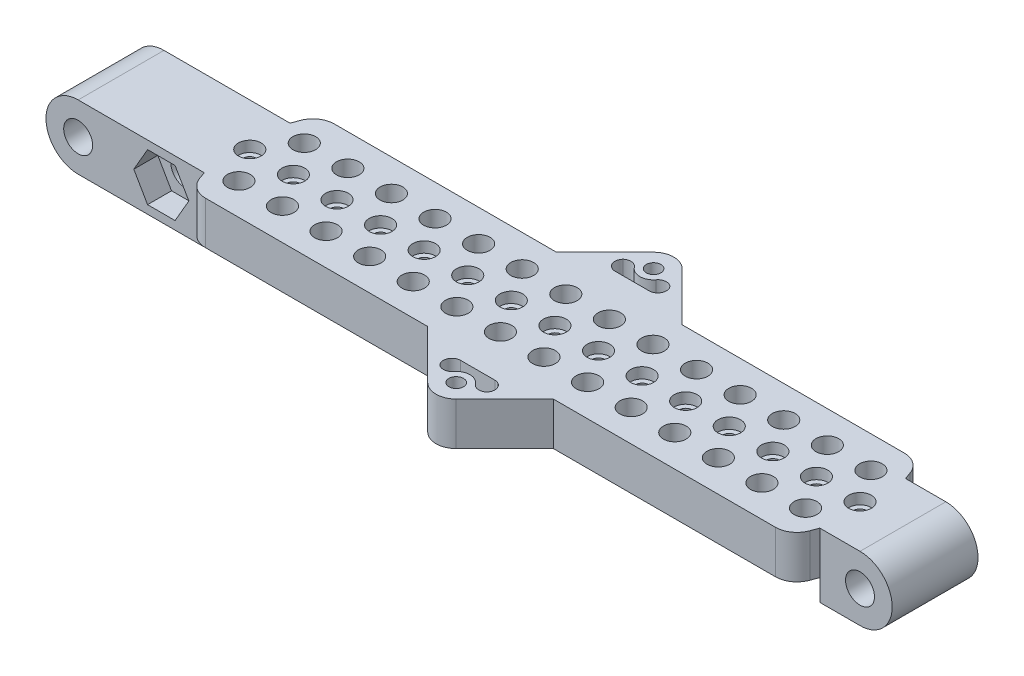
from build123d import *

# Parameters (mm, degrees)
SKETCH1_R           = 4
SKETCH1_R_2         = 1.5
BOSS_EXTRUDE1_DEPTH = 15
SKETCH3_R           = 2.65
CUT_EXTRUDE1_DEPTH  = 2.5
BOSS_EXTRUDE2_START = -15
BOSS_EXTRUDE2_DEPTH = 15
LPATTERN2_COUNT     = 14
LPATTERN2_PITCH     = 10.16
LPATTERN3_COUNT     = 2
LPATTERN3_PITCH     = 142.24
SKETCH4_R           = 2.65
BOSS_EXTRUDE4_DEPTH = 10
FILLET1_R           = 5
SKETCH5_R           = 1.7
BOSS_EXTRUDE5_DEPTH = 10
FILLET2_R           = 2
BOSS_EXTRUDE6_DEPTH = 15
BOSS_EXTRUDE7_DEPTH = 20
CUT_EXTRUDE2_DEPTH  = 5.588
SKETCH8_R           = 3.3734375
CUT_EXTRUDE3_DEPTH  = 152.764381856
BOSS_EXTRUDE8_DEPTH = 15
BOSS_EXTRUDE9_DEPTH = 20
SKETCH13_R          = 3.3734375
CUT_EXTRUDE4_DEPTH  = 165.812492245


with BuildPart() as part:
    # Sketch1 → Boss-Extrude1 (new body)
    with BuildSketch(Plane(origin=(0, 0, 0), x_dir=(1, 0, 0), z_dir=(0, 1, 0))):
        with Locations(Location((0, 0, 0), (0, 0, 270))):
            Circle(SKETCH1_R)
        with Locations(Location((0, 0, 0), (0, 0, 270))):
            Circle(SKETCH1_R_2, mode=Mode.SUBTRACT)
    boss_extrude1 = extrude(amount=BOSS_EXTRUDE1_DEPTH)

    # Sketch3 → Cut-Extrude1 (cut)
    with BuildSketch(Plane(origin=(0, 15, 0), x_dir=(1, 0, 0), z_dir=(0, 1, 0))):
        with Locations(Location((0, 0, 0), (0, 0, 270))):
            Circle(SKETCH3_R)
    cut_extrude1 = extrude(amount=-CUT_EXTRUDE1_DEPTH, mode=Mode.SUBTRACT)

    # Sketch2 → Boss-Extrude2 (add)
    with BuildSketch(Plane(origin=(0, 15, 0), x_dir=(1, 0, 0), z_dir=(0, 1, 0)).offset(BOSS_EXTRUDE2_START)):
        with BuildLine():
            Line((0, 4), (10.16, 4))
            ThreePointArc((10.16, 4), (6.16, 0), (10.16, -4))
            Line((10.16, -4), (0, -4))
            ThreePointArc((0, -4), (4, 0), (0, 4))
        make_face()
    extrude(amount=BOSS_EXTRUDE2_DEPTH)


with BuildPart() as lpattern2_1:
    # LPattern2: pattern copy
    add(part.part.moved(Location(Vector(1, 0, 0) * (1 * LPATTERN2_PITCH))))


with BuildPart() as lpattern2_2:
    # LPattern2: pattern copy
    add(part.part.moved(Location(Vector(1, 0, 0) * (2 * LPATTERN2_PITCH))))


with BuildPart() as lpattern2_3:
    # LPattern2: pattern copy
    add(part.part.moved(Location(Vector(1, 0, 0) * (3 * LPATTERN2_PITCH))))


with BuildPart() as lpattern2_4:
    # LPattern2: pattern copy
    add(part.part.moved(Location(Vector(1, 0, 0) * (4 * LPATTERN2_PITCH))))


with BuildPart() as lpattern2_5:
    # LPattern2: pattern copy
    add(part.part.moved(Location(Vector(1, 0, 0) * (5 * LPATTERN2_PITCH))))


with BuildPart() as lpattern2_6:
    # LPattern2: pattern copy
    add(part.part.moved(Location(Vector(1, 0, 0) * (6 * LPATTERN2_PITCH))))


with BuildPart() as lpattern2_7:
    # LPattern2: pattern copy
    add(part.part.moved(Location(Vector(1, 0, 0) * (7 * LPATTERN2_PITCH))))


with BuildPart() as lpattern2_8:
    # LPattern2: pattern copy
    add(part.part.moved(Location(Vector(1, 0, 0) * (8 * LPATTERN2_PITCH))))


with BuildPart() as lpattern2_9:
    # LPattern2: pattern copy
    add(part.part.moved(Location(Vector(1, 0, 0) * (9 * LPATTERN2_PITCH))))


with BuildPart() as lpattern2_10:
    # LPattern2: pattern copy
    add(part.part.moved(Location(Vector(1, 0, 0) * (10 * LPATTERN2_PITCH))))


with BuildPart() as lpattern2_11:
    # LPattern2: pattern copy
    add(part.part.moved(Location(Vector(1, 0, 0) * (11 * LPATTERN2_PITCH))))


with BuildPart() as lpattern2_12:
    # LPattern2: pattern copy
    add(part.part.moved(Location(Vector(1, 0, 0) * (12 * LPATTERN2_PITCH))))


with BuildPart() as lpattern2_13:
    # LPattern2: pattern copy
    add(part.part.moved(Location(Vector(1, 0, 0) * (13 * LPATTERN2_PITCH))))

    # LPattern3: Boss-Extrude1, Cut-Extrude1 ×2
    with Locations(*[(i * LPATTERN3_PITCH, 0, 0) for i in range(1, LPATTERN3_COUNT)]):
        add(boss_extrude1)
        add(cut_extrude1, mode=Mode.SUBTRACT)


with BuildPart() as lpattern2_11_1:
    add(lpattern2_11.part)

    # Combine1: union LPattern2_6, LPattern2_1, LPattern2_13, LPattern2_8, LPattern2_3, LPattern2_10, LPattern2_5, LPattern2_12, LPattern2_7, LPattern2_2, LPattern2_4, LPattern2_9, part
    add(lpattern2_6.part)
    add(lpattern2_1.part)
    add(lpattern2_13.part)
    add(lpattern2_8.part)
    add(lpattern2_3.part)
    add(lpattern2_10.part)
    add(lpattern2_5.part)
    add(lpattern2_12.part)
    add(lpattern2_7.part)
    add(lpattern2_2.part)
    add(lpattern2_4.part)
    add(lpattern2_9.part)
    add(part.part)

    # Sketch4 → Boss-Extrude4 (add)
    with BuildSketch(Plane(origin=(0, 15, 0), x_dir=(1, 0, 0), z_dir=(0, 1, 0))):
        with BuildLine():
            Line((-3.758770483, 1.368080573), (1.202842424, 15))
            Line((1.202842424, 15), (141.037157576, 15))
            Line((141.037157576, 15), (145.998770483, 1.368080573))
            ThreePointArc((145.998770483, 1.368080573), (146.24, 0), (145.998770483, -1.368080573))
            Line((145.998770483, -1.368080573), (141.037157576, -15))
            Line((141.037157576, -15), (1.202842424, -15))
            Line((1.202842424, -15), (-3.758770483, -1.368080573))
            ThreePointArc((-3.758770483, -1.368080573), (-4, 0), (-3.758770483, 1.368080573))
        make_face()
        with Locations(Location((5.08, 7.62, 0), (0, 0, 270))):
            Circle(SKETCH4_R, mode=Mode.SUBTRACT)
        with Locations(Location((15.24, 7.62, 0), (0, 0, 270))):
            Circle(SKETCH4_R, mode=Mode.SUBTRACT)
        with Locations(Location((25.4, 7.62, 0), (0, 0, 270))):
            Circle(SKETCH4_R, mode=Mode.SUBTRACT)
        with Locations(Location((35.56, 7.62, 0), (0, 0, 270))):
            Circle(SKETCH4_R, mode=Mode.SUBTRACT)
        with Locations(Location((45.72, 7.62, 0), (0, 0, 270))):
            Circle(SKETCH4_R, mode=Mode.SUBTRACT)
        with Locations(Location((55.88, 7.62, 0), (0, 0, 270))):
            Circle(SKETCH4_R, mode=Mode.SUBTRACT)
        with Locations(Location((66.04, 7.62, 0), (0, 0, 270))):
            Circle(SKETCH4_R, mode=Mode.SUBTRACT)
        with Locations(Location((76.2, 7.62, 0), (0, 0, 270))):
            Circle(SKETCH4_R, mode=Mode.SUBTRACT)
        with Locations(Location((86.36, 7.62, 0), (0, 0, 270))):
            Circle(SKETCH4_R, mode=Mode.SUBTRACT)
        with Locations(Location((96.52, 7.62, 0), (0, 0, 270))):
            Circle(SKETCH4_R, mode=Mode.SUBTRACT)
        with Locations(Location((106.68, 7.62, 0), (0, 0, 270))):
            Circle(SKETCH4_R, mode=Mode.SUBTRACT)
        with Locations(Location((116.84, 7.62, 0), (0, 0, 270))):
            Circle(SKETCH4_R, mode=Mode.SUBTRACT)
        with Locations(Location((127, 7.62, 0), (0, 0, 270))):
            Circle(SKETCH4_R, mode=Mode.SUBTRACT)
        with Locations(Location((137.16, 7.62, 0), (0, 0, 270))):
            Circle(SKETCH4_R, mode=Mode.SUBTRACT)
        with Locations(Location((15.24, -7.62, 0), (0, 0, 270))):
            Circle(SKETCH4_R, mode=Mode.SUBTRACT)
        with Locations(Location((25.4, -7.62, 0), (0, 0, 270))):
            Circle(SKETCH4_R, mode=Mode.SUBTRACT)
        with Locations(Location((35.56, -7.62, 0), (0, 0, 270))):
            Circle(SKETCH4_R, mode=Mode.SUBTRACT)
        with Locations(Location((45.72, -7.62, 0), (0, 0, 270))):
            Circle(SKETCH4_R, mode=Mode.SUBTRACT)
        with Locations(Location((55.88, -7.62, 0), (0, 0, 270))):
            Circle(SKETCH4_R, mode=Mode.SUBTRACT)
        with Locations(Location((66.04, -7.62, 0), (0, 0, 270))):
            Circle(SKETCH4_R, mode=Mode.SUBTRACT)
        with Locations(Location((76.2, -7.62, 0), (0, 0, 270))):
            Circle(SKETCH4_R, mode=Mode.SUBTRACT)
        with Locations(Location((86.36, -7.62, 0), (0, 0, 270))):
            Circle(SKETCH4_R, mode=Mode.SUBTRACT)
        with Locations(Location((96.52, -7.62, 0), (0, 0, 270))):
            Circle(SKETCH4_R, mode=Mode.SUBTRACT)
        with Locations(Location((106.68, -7.62, 0), (0, 0, 270))):
            Circle(SKETCH4_R, mode=Mode.SUBTRACT)
        with Locations(Location((116.84, -7.62, 0), (0, 0, 270))):
            Circle(SKETCH4_R, mode=Mode.SUBTRACT)
        with Locations(Location((127, -7.62, 0), (0, 0, 270))):
            Circle(SKETCH4_R, mode=Mode.SUBTRACT)
        with Locations(Location((137.16, -7.62, 0), (0, 0, 270))):
            Circle(SKETCH4_R, mode=Mode.SUBTRACT)
        with Locations(Location((5.08, -7.62, 0), (0, 0, 270))):
            Circle(SKETCH4_R, mode=Mode.SUBTRACT)
        with Locations(Location((0, 0, 0), (0, 0, 270))):
            Circle(SKETCH4_R, mode=Mode.SUBTRACT)
        with Locations(Location((10.16, 0, 0), (0, 0, 270))):
            Circle(SKETCH4_R, mode=Mode.SUBTRACT)
        with Locations(Location((20.32, 0, 0), (0, 0, 270))):
            Circle(SKETCH4_R, mode=Mode.SUBTRACT)
        with Locations(Location((30.48, 0, 0), (0, 0, 270))):
            Circle(SKETCH4_R, mode=Mode.SUBTRACT)
        with Locations(Location((40.64, 0, 0), (0, 0, 270))):
            Circle(SKETCH4_R, mode=Mode.SUBTRACT)
        with Locations(Location((50.8, 0, 0), (0, 0, 270))):
            Circle(SKETCH4_R, mode=Mode.SUBTRACT)
        with Locations(Location((60.96, 0, 0), (0, 0, 270))):
            Circle(SKETCH4_R, mode=Mode.SUBTRACT)
        with Locations(Location((71.12, 0, 0), (0, 0, 270))):
            Circle(SKETCH4_R, mode=Mode.SUBTRACT)
        with Locations(Location((81.28, 0, 0), (0, 0, 270))):
            Circle(SKETCH4_R, mode=Mode.SUBTRACT)
        with Locations(Location((91.44, 0, 0), (0, 0, 270))):
            Circle(SKETCH4_R, mode=Mode.SUBTRACT)
        with Locations(Location((101.6, 0, 0), (0, 0, 270))):
            Circle(SKETCH4_R, mode=Mode.SUBTRACT)
        with Locations(Location((111.76, 0, 0), (0, 0, 270))):
            Circle(SKETCH4_R, mode=Mode.SUBTRACT)
        with Locations(Location((121.92, 0, 0), (0, 0, 270))):
            Circle(SKETCH4_R, mode=Mode.SUBTRACT)
        with Locations(Location((132.08, 0, 0), (0, 0, 270))):
            Circle(SKETCH4_R, mode=Mode.SUBTRACT)
        with Locations(Location((142.24, 0, 0), (0, 0, 270))):
            Circle(SKETCH4_R, mode=Mode.SUBTRACT)
    extrude(amount=-BOSS_EXTRUDE4_DEPTH)

    # Fillet1
    fillet1_edges = [lpattern2_11_1.edges().sort_by_distance(p)[0] for p in [
        (1.202842424, 10, -15),
        (141.037157576, 10, -15),
        (141.037157576, 10, 15),
        (1.202842424, 10, 15),
    ]]
    fillet(fillet1_edges, radius=FILLET1_R)

    # Sketch5 → Boss-Extrude5 (add)
    # profile 1 of 2: a face of its own
    with BuildSketch(Plane(origin=(0, 15, 0), x_dir=(1, 0, 0), z_dir=(0, 1, 0))):
        with BuildLine():
            Line((67.796598128, 26.323401872), (56.473196257, 15))
            Line((56.473196257, 15), (85.766803743, 15))
            Line((85.766803743, 15), (74.443401872, 26.323401872))
            ThreePointArc((74.443401872, 26.323401872), (71.12, 27.7), (67.796598128, 26.323401872))
        make_face()
        with Locations(Location((71.12, 23, 0), (0, 0, 270))):
            Circle(SKETCH5_R, mode=Mode.SUBTRACT)
        with BuildLine():
            Line((62.301623382, 18), (67.996315911, 23.694692529))
            ThreePointArc((67.996315911, 23.694692529), (71.12, 19.8), (74.243684089, 23.694692529))
            Line((74.243684089, 23.694692529), (79.938376618, 18))
            Line((79.938376618, 18), (62.301623382, 18))
        make_face(mode=Mode.SUBTRACT)
    # profile 2 of 2: a face of its own
    with BuildSketch(Plane(origin=(0, 15, 0), x_dir=(1, 0, 0), z_dir=(0, 1, 0))):
        with BuildLine():
            Line((74.443401872, -26.323401872), (85.766803743, -15))
            Line((85.766803743, -15), (56.473196257, -15))
            Line((56.473196257, -15), (67.796598128, -26.323401872))
            ThreePointArc((67.796598128, -26.323401872), (71.12, -27.7), (74.443401872, -26.323401872))
        make_face()
        with Locations(Location((71.12, -23, 0), (0, 0, 90))):
            Circle(SKETCH5_R, mode=Mode.SUBTRACT)
        with BuildLine():
            Line((79.938376618, -18), (74.243684089, -23.694692529))
            ThreePointArc((74.243684089, -23.694692529), (71.12, -19.8), (67.996315911, -23.694692529))
            Line((67.996315911, -23.694692529), (62.301623382, -18))
            Line((62.301623382, -18), (79.938376618, -18))
        make_face(mode=Mode.SUBTRACT)
    extrude(amount=-BOSS_EXTRUDE5_DEPTH)

    # Fillet2
    # the kernel refuses this fillet: 2 mm, written as the material it adds along each edge
    with BuildSketch(Plane(origin=(79.938376618, 15, -18), x_dir=(-0.7071067811865454, 0, -0.7071067811865498), z_dir=(0, -1, 0)), Plane(origin=(79.938376618, 15, 18), x_dir=(-1, 0, 0), z_dir=(0, -1, 0))) as fillet2_piece_1:
        with BuildLine():
            CenterArc((FILLET2_R * 2.41421356237, -FILLET2_R), FILLET2_R, 90, 135)
            Line((FILLET2_R * 1.70710678119, -FILLET2_R * 1.70710678119), (0, 0))
            Line((0, 0), (FILLET2_R * 2.41421356237, 0))
        make_face()
    extrude(amount=10)
    with BuildSketch(Plane(origin=(62.301623382, 15, -18), x_dir=(0.7071067811865449, 0, -0.70710678118655), z_dir=(0, -1, 0)), Plane(origin=(62.301623382, 15, 18), x_dir=(1, 0, 0), z_dir=(0, -1, 0))) as fillet2_piece_2:
        with BuildLine():
            CenterArc((FILLET2_R * 2.41421356237, FILLET2_R), FILLET2_R, 135, 135)
            Line((FILLET2_R * 1.70710678119, FILLET2_R * 1.70710678119), (0, 0))
            Line((0, 0), (FILLET2_R * 2.41421356237, 0))
        make_face()
    extrude(amount=10)
    with BuildSketch(Plane(origin=(67.996315911, 15, -23.694692529), x_dir=(-0.7071067811865465, 0, 0.7071067811865486), z_dir=(0, -1, 0)), Plane(origin=(74.243684089, 15, 23.694692529), x_dir=(0.7071067811865418, 0, -0.7071067811865531), z_dir=(0, -1, 0))) as fillet2_piece_3:
        with BuildLine():
            CenterArc((3.435112807, -2), FILLET2_R, 90, 97.73638004)
            ThreePointArc((1.453316957, -2.269230769), (0.977167787, -0.974178011), (0, 0))
            Line((0, 0), (3.435112807, 0))
        make_face()
    extrude(amount=10)
    with BuildSketch(Plane(origin=(74.243684089, 15, -23.694692529), x_dir=(-0.21409916145634816, 0, 0.9768119312660387), z_dir=(0, -1, 0)), Plane(origin=(67.996315911, 15, 23.694692529), x_dir=(0.21409916145635713, 0, -0.9768119312660368), z_dir=(0, -1, 0))) as fillet2_piece_4:
        with BuildLine():
            CenterArc((3.5368255, -1.81407425), FILLET2_R, 114.900937496, 97.73638004)
            Line((1.852622881, -2.892712993), (0, 0))
            ThreePointArc((0, 0), (1.347362095, -0.2974812), (2.69472419, 0))
        make_face()
    extrude(amount=10)

    # Sketch6 → Boss-Extrude6 (add)
    with BuildSketch(Plane(origin=(0, 15, 0), x_dir=(1, 0, 0), z_dir=(0, 1, 0))):
        with BuildLine():
            Line((-0.617008747, 10), (-30, 10))
            Line((-30, 10), (-30, -10))
            Line((-30, -10), (-0.617008747, -10))
            Line((-0.617008747, -10), (0, -2.65))
            ThreePointArc((0, -2.65), (-2.65, 0), (0, 2.65))
            Line((0, 2.65), (-0.617008747, 10))
        make_face()
    extrude(amount=-BOSS_EXTRUDE6_DEPTH)

    # Sketch10 → Boss-Extrude7 (add)
    with BuildSketch(Plane.XY.offset(10)):
        with BuildLine():
            Line((-30, 15), (-30, 0))
            ThreePointArc((-30, 0), (-37.5, 7.5), (-30, 15))
        make_face()
    extrude(amount=-BOSS_EXTRUDE7_DEPTH)

    # Sketch7 → Cut-Extrude2 (cut)
    with BuildSketch(Plane.XY.offset(10)):
        Polygon((-7.409106314, 1.94375), (-4.201203881, 7.5), (-7.409106314, 13.05625), (-13.82491118, 13.05625), (-17.032813614, 7.5), (-13.82491118, 1.94375), align=None)
    cut_extrude2 = extrude(amount=-CUT_EXTRUDE2_DEPTH, mode=Mode.SUBTRACT)

    # Sketch8 → Cut-Extrude3 (cut, through all)
    with BuildSketch(Plane.XY.offset(10)):
        with Locations((-10.617008747, 7.5)):
            Circle(SKETCH8_R)
        with Locations((-30, 7.5)):
            Circle(SKETCH8_R)
    extrude(amount=-CUT_EXTRUDE3_DEPTH, mode=Mode.SUBTRACT)

    # Mirror2: Cut-Extrude2 across plane
    add(cut_extrude2.mirror(Plane.XY), mode=Mode.SUBTRACT)

    # Sketch11 → Boss-Extrude8 (add, through all)
    with BuildSketch(Plane(origin=(0, 15, 0), x_dir=(1, 0, 0), z_dir=(0, 1, 0))):
        with BuildLine():
            Line((142.857008747, 10), (152.24, 10))
            Line((152.24, 10), (152.24, -10))
            Line((152.24, -10), (142.857008747, -10))
            Line((142.857008747, -10), (142.24, -2.65))
            ThreePointArc((142.24, -2.65), (144.89, 0), (142.24, 2.65))
            Line((142.24, 2.65), (142.857008747, 10))
        make_face()
    extrude(amount=-BOSS_EXTRUDE8_DEPTH)

    # Sketch12 → Boss-Extrude9 (add)
    with BuildSketch(Plane.XY.offset(10)):
        with BuildLine():
            Line((152.24, 15), (152.24, 0))
            ThreePointArc((152.24, 0), (159.74, 7.5), (152.24, 15))
        make_face()
    extrude(amount=-BOSS_EXTRUDE9_DEPTH)

    # Sketch13 → Cut-Extrude4 (cut, through all)
    with BuildSketch(Plane.XY.offset(10)):
        with Locations((152.24, 7.5)):
            Circle(SKETCH13_R)
    extrude(amount=-CUT_EXTRUDE4_DEPTH, mode=Mode.SUBTRACT)


solid = lpattern2_11_1.part
